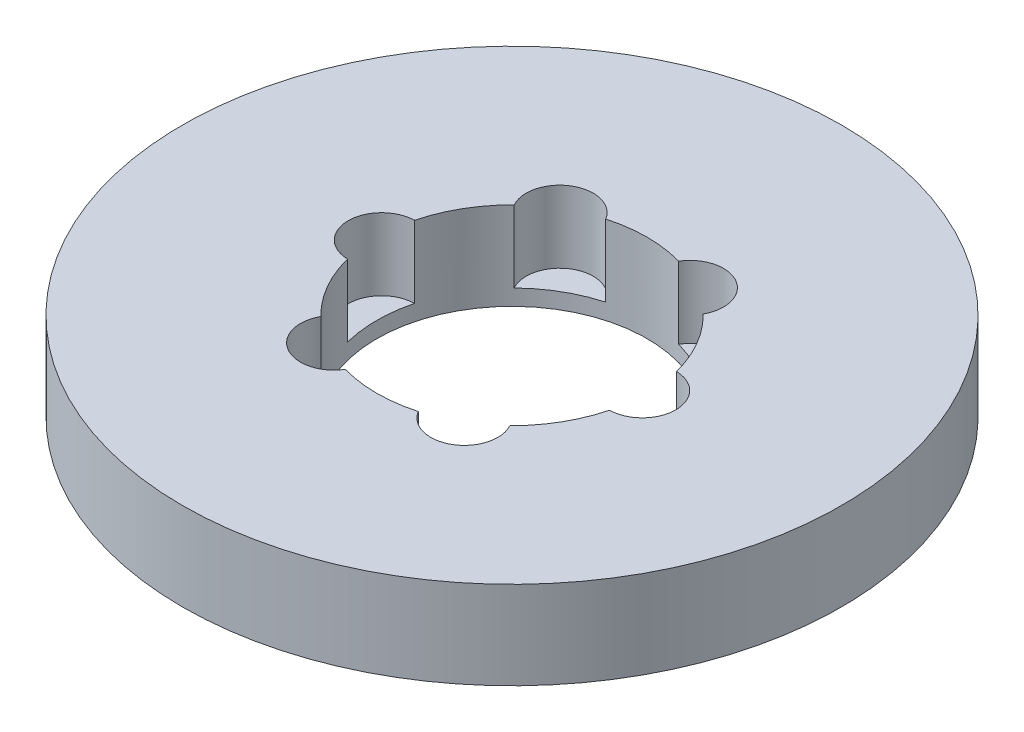
from build123d import *

# Parameters (mm, degrees)
SKETCH1_R           = 97.5
BOSS_EXTRUDE1_DEPTH = 26
SKETCH2_R           = 40
CUT_EXTRUDE1_DEPTH  = 141.315715442
SKETCH3_R           = 9.915483769
CUT_EXTRUDE2_DEPTH  = 21.289343775
CIRPATTERN1_COUNT   = 6


with BuildPart() as part:
    # Sketch1 → Boss-Extrude1 (new body)
    with BuildSketch(Plane(origin=(0, 0, 0), x_dir=(1, 0, 0), z_dir=(0, 1, 0))):
        Circle(SKETCH1_R)
    extrude(amount=BOSS_EXTRUDE1_DEPTH)

    # Sketch2 → Cut-Extrude1 (cut, through all)
    with BuildSketch(Plane(origin=(0, 0, 0), x_dir=(1, 0, 0), z_dir=(0, 1, 0))):
        Circle(SKETCH2_R)
    extrude(amount=CUT_EXTRUDE1_DEPTH, mode=Mode.SUBTRACT)

    # Sketch3 → Cut-Extrude2 (cut)
    with BuildSketch(Plane(origin=(0, 26, 0), x_dir=(1, 0, 0), z_dir=(0, 1, 0))):
        with Locations((-38.557268576, 0)):
            Circle(SKETCH3_R)
    cut_extrude2 = extrude(amount=-CUT_EXTRUDE2_DEPTH, mode=Mode.SUBTRACT)

    # CirPattern1: Cut-Extrude2 ×6 about axis
    cirpattern1_axis = Axis((0, 0, 0), (0, 1, 0))
    for i in range(1, CIRPATTERN1_COUNT):
        add(cut_extrude2.rotate(cirpattern1_axis, i * 360 / CIRPATTERN1_COUNT), mode=Mode.SUBTRACT)


solid = part.part
